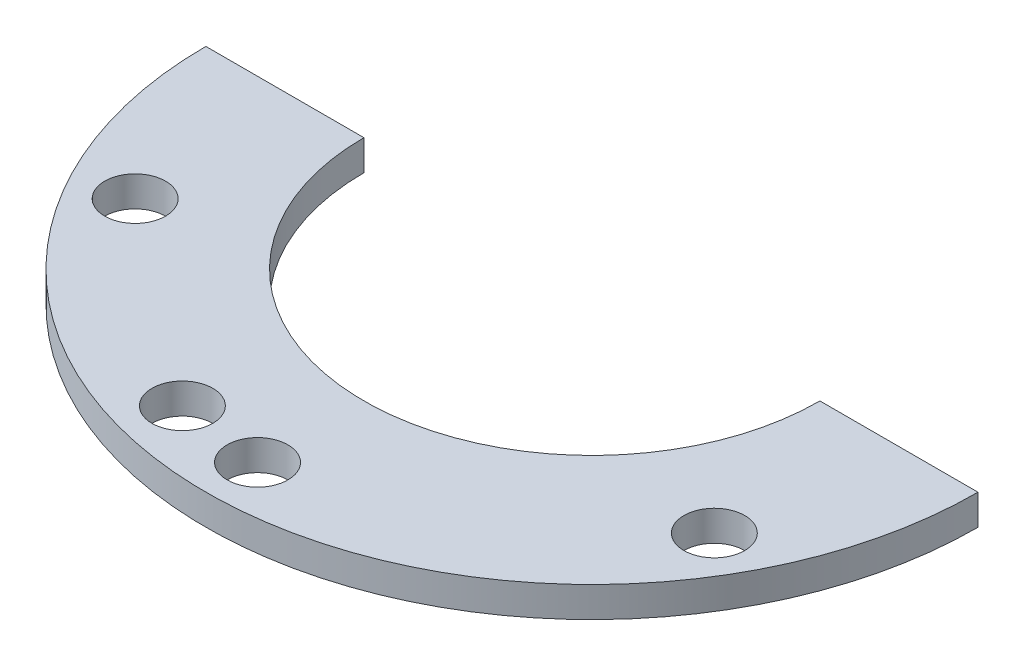
from build123d import *

# Parameters (mm, degrees)
SKETCH1_R               = 12.7
BOSS_EXTRUDE1_DEPTH     = 1
CUT_EXTRUDE1_DEPTH      = 18.98832955
CUT_EXTRUDE1_DEPTH_BACK = 18.98832955
SKETCH19_R              = 1
CUT_EXTRUDE2_DEPTH      = 18.98832955
CUT_EXTRUDE2_DEPTH_BACK = 18.98832955
SKETCH20_R              = 7.5
SKETCH21_W              = 65.874202484
SKETCH21_H              = 51.979273979
CUT_EXTRUDE3_DEPTH      = 18.98832955


with BuildPart() as part:
    # Sketch1 → Boss-Extrude1 (new body)
    with BuildSketch(Plane(origin=(0, 0, 0), x_dir=(1, 0, 0), z_dir=(0, 1, 0))):
        Circle(SKETCH1_R)
    extrude(amount=BOSS_EXTRUDE1_DEPTH)

    # Sketch19 → Cut-Extrude1 (cut, two sides: drawn at the far end of the back side and taken through both)
    with BuildSketch(Plane(origin=(0, 1, 0), x_dir=(1, 0, 0), z_dir=(0, 1, 0)).offset(-CUT_EXTRUDE1_DEPTH_BACK)):
        with Locations((0, 11)):
            Circle(SKETCH19_R)
        with Locations((9.526279442, 5.5)):
            Circle(SKETCH19_R)
        with Locations((9.526279442, -5.5)):
            Circle(SKETCH19_R)
        with Locations((0, -11)):
            Circle(SKETCH19_R)
        with Locations((-9.526279442, -5.5)):
            Circle(SKETCH19_R)
        with Locations((-9.526279442, 5.5)):
            Circle(SKETCH19_R)
        with Locations((-2.847009496, -10.625184089)):
            Circle(SKETCH19_R)
    extrude(amount=CUT_EXTRUDE1_DEPTH + CUT_EXTRUDE1_DEPTH_BACK, mode=Mode.SUBTRACT)

    # Sketch20 → Cut-Extrude2 (cut, two sides: drawn at the far end of the back side and taken through both)
    with BuildSketch(Plane(origin=(0, 1, 0), x_dir=(1, 0, 0), z_dir=(0, 1, 0)).offset(-CUT_EXTRUDE2_DEPTH_BACK)):
        Circle(SKETCH20_R)
    extrude(amount=CUT_EXTRUDE2_DEPTH + CUT_EXTRUDE2_DEPTH_BACK, mode=Mode.SUBTRACT)

    # Sketch21 → Cut-Extrude3 (cut, through all)
    with BuildSketch(Plane.XY):
        with Locations((-3.816154381, 6.321647006)):
            Rectangle(SKETCH21_W, SKETCH21_H)
    extrude(amount=-CUT_EXTRUDE3_DEPTH, mode=Mode.SUBTRACT)


solid = part.part
